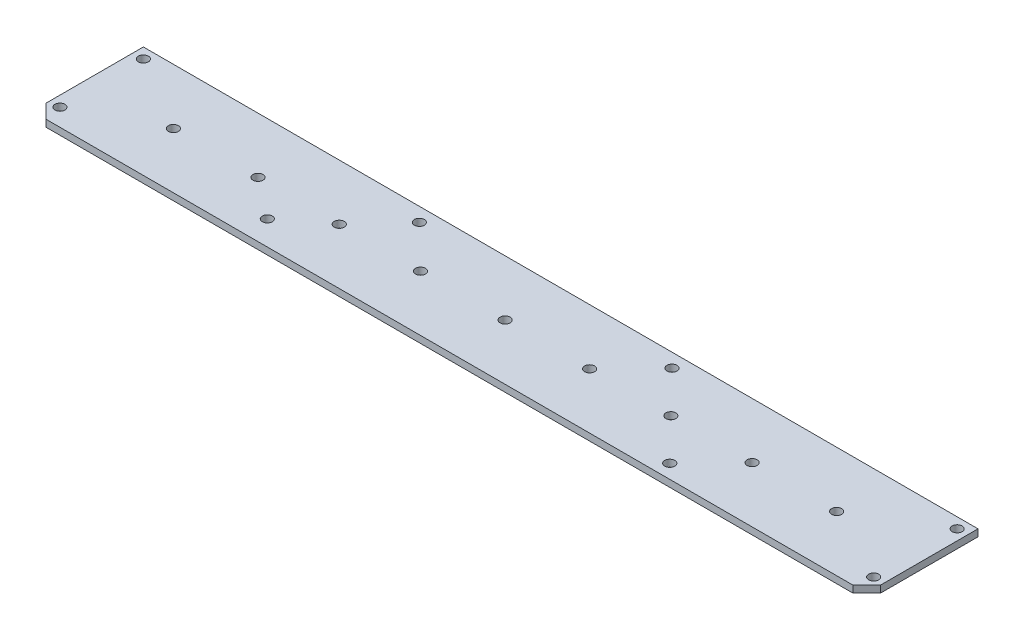
from build123d import *

# Parameters (mm, degrees)
SKETCH2_W           = 381
SKETCH2_H           = 50.8
BOSS_EXTRUDE1_DEPTH = 3.175
SKETCH3_R           = 2.286
CUT_EXTRUDE1_DEPTH  = 385.384860036


with BuildPart() as part:
    # Sketch2 → Boss-Extrude1 (new body)
    with BuildSketch(Plane(origin=(0, 0, 0), x_dir=(1, 0, 0), z_dir=(0, 1, 0))):
        with Locations((190.5, 25.4)):
            Rectangle(SKETCH2_W, SKETCH2_H)
    extrude(amount=BOSS_EXTRUDE1_DEPTH)

    # Sketch3 → Cut-Extrude1 (cut, through all)
    with BuildSketch(Plane(origin=(0, 0, 0), x_dir=(1, 0, 0), z_dir=(0, 1, 0))):
        with Locations((96.266, 11.1125)):
            Circle(SKETCH3_R)
        with Locations((284.734, 6.35)):
            Circle(SKETCH3_R)
        with Locations((132.334, 44.45)):
            Circle(SKETCH3_R)
        with Locations((247.65, 44.45)):
            Circle(SKETCH3_R)
        with Locations((4.7625, 7.9375)):
            Circle(SKETCH3_R)
        with Locations((4.7625, 46.0375)):
            Circle(SKETCH3_R)
        with Locations((39.116, 25.4)):
            Circle(SKETCH3_R)
        with Locations((77.724, 25.4)):
            Circle(SKETCH3_R)
        with Locations((114.808, 25.4)):
            Circle(SKETCH3_R)
        with Locations((190.5, 25.4)):
            Circle(SKETCH3_R)
        with Locations((341.884, 25.4)):
            Circle(SKETCH3_R)
        with Locations((376.2375, 7.9375)):
            Circle(SKETCH3_R)
        with Locations((376.2375, 46.0375)):
            Circle(SKETCH3_R)
        with Locations((303.276, 25.4)):
            Circle(SKETCH3_R)
        with Locations((266.192, 25.4)):
            Circle(SKETCH3_R)
        with Locations((229.108, 25.4)):
            Circle(SKETCH3_R)
        with Locations((151.892, 25.4)):
            Circle(SKETCH3_R)
        Polygon((0, 6.35), (6.35, 0), (0, 0), align=None)
        Polygon((374.65, 0), (381, 6.35), (381, 0), align=None)
    extrude(amount=CUT_EXTRUDE1_DEPTH, mode=Mode.SUBTRACT)


solid = part.part
